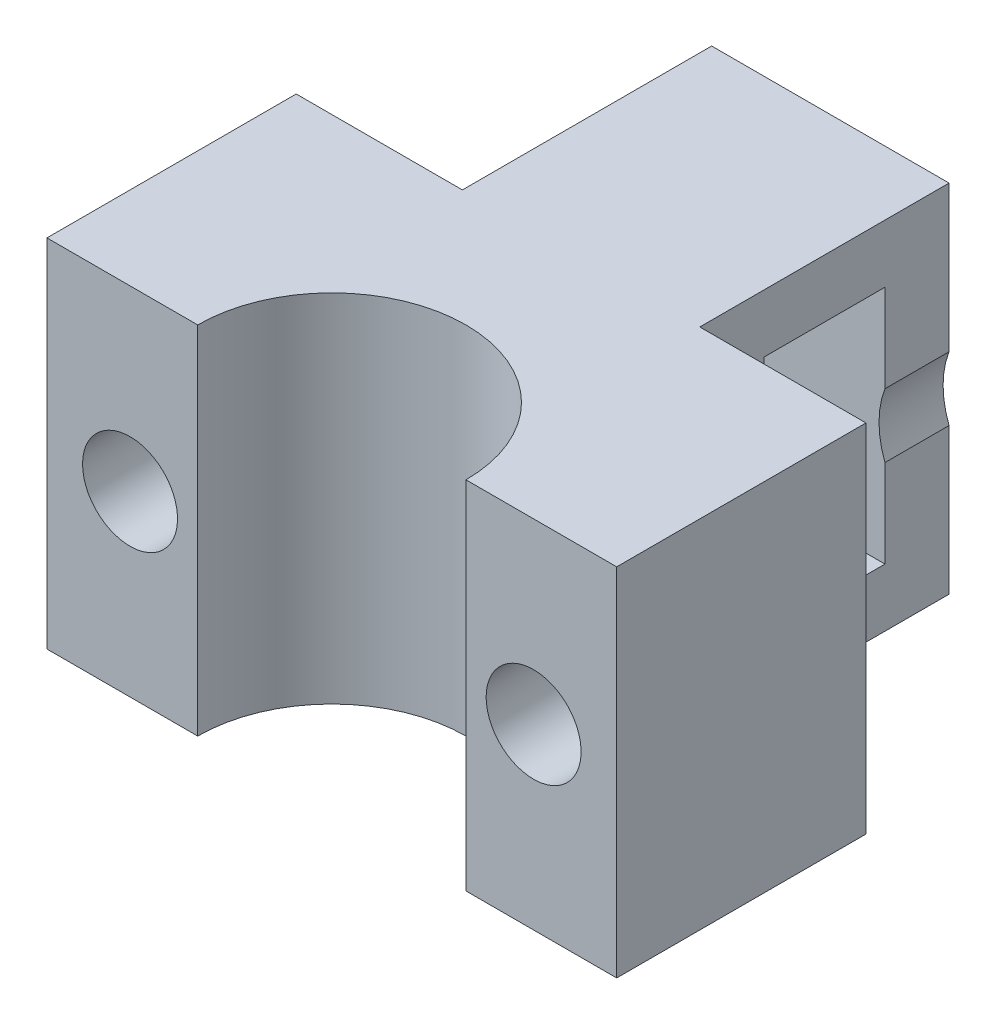
from build123d import *

# Parameters (mm, degrees)
SKETCH_1_W          = 48
SKETCH_1_H          = 20
EXTRUDE_1_DEPTH     = 30
SKETCH_2_W          = 14
SKETCH_2_H          = 30
CUT_EXTRUDE_1_DEPTH = 7
SKETCH_7_W          = 22
SKETCH_7_H          = 30
EXTRUDE_2_DEPTH     = 48
SKETCH_8_W          = 21
SKETCH_8_H          = 30
CUT_EXTRUDE_2_DEPTH = 14
SKETCH_9_W          = 21
SKETCH_9_H          = 30
CUT_EXTRUDE_3_DEPTH = 14
SKETCH_11_W         = 10.2
SKETCH_11_H         = 20.2
CUT_EXTRUDE_4_DEPTH = 56.497747702
SKETCH_13_R         = 4
CUT_EXTRUDE_5_DEPTH = 44.783558558
SKETCH_14_R         = 4
CUT_EXTRUDE_6_DEPTH = 44.783558558
FILLET_1_R          = 7
SKETCH_20_R         = 7.5
CUT_EXTRUDE_8_DEPTH = 44.783558558
SKETCH2_R           = 11.3
CUT_EXTRUDE1_DEPTH  = 51


with BuildPart() as part:
    # Эскиз1 → Бобышка-Вытянуть1 (new body)
    with BuildSketch(Plane(origin=(0, 0, 0), x_dir=(1, 0, 0), z_dir=(0, 1, 0))):
        Rectangle(SKETCH_1_W, SKETCH_1_H)
    extrude(amount=EXTRUDE_1_DEPTH)

    # Эскиз2 → Вырез-Вытянуть1 (cut)
    with BuildSketch(Plane.XY.offset(10)):
        with Locations((0, 15)):
            Rectangle(SKETCH_2_W, SKETCH_2_H)
    extrude(amount=-CUT_EXTRUDE_1_DEPTH, mode=Mode.SUBTRACT)

    # Эскиз7 → Бобышка-Вытянуть2 (add)
    with BuildSketch(Plane(origin=(24, 0, 0), x_dir=(0, 0, -1), z_dir=(1, 0, 0))):
        with Locations((21, 15)):
            Rectangle(SKETCH_7_W, SKETCH_7_H)
    extrude(amount=-EXTRUDE_2_DEPTH)

    # Эскиз8 → Вырез-Вытянуть2 (cut)
    with BuildSketch(Plane(origin=(24, 0, 0), x_dir=(0, 0, -1), z_dir=(1, 0, 0))):
        with Locations((21.5, 15)):
            Rectangle(SKETCH_8_W, SKETCH_8_H)
    extrude(amount=-CUT_EXTRUDE_2_DEPTH, mode=Mode.SUBTRACT)

    # Эскиз9 → Вырез-Вытянуть3 (cut)
    with BuildSketch(Plane.ZY.offset(24)):
        with Locations((-21.5, 15)):
            Rectangle(SKETCH_9_W, SKETCH_9_H)
    extrude(amount=-CUT_EXTRUDE_3_DEPTH, mode=Mode.SUBTRACT)

    # Эскиз11 → Вырез-Вытянуть4 (cut, through all)
    with BuildSketch(Plane.ZY.offset(10)):
        with Locations((-21.5, 15)):
            Rectangle(SKETCH_11_W, SKETCH_11_H)
    extrude(amount=-CUT_EXTRUDE_4_DEPTH, mode=Mode.SUBTRACT)

    # Эскиз13 → Вырез-Вытянуть5 (cut, through all)
    with BuildSketch(Plane(origin=(0, 0, -11), x_dir=(-1, 0, 0), z_dir=(0, 0, -1))):
        with Locations((17, 15)):
            Circle(SKETCH_13_R)
    extrude(amount=-CUT_EXTRUDE_5_DEPTH, mode=Mode.SUBTRACT)

    # Эскиз14 → Вырез-Вытянуть6 (cut, through all)
    with BuildSketch(Plane(origin=(0, 0, -11), x_dir=(-1, 0, 0), z_dir=(0, 0, -1))):
        with Locations((-17, 15)):
            Circle(SKETCH_14_R)
    extrude(amount=-CUT_EXTRUDE_6_DEPTH, mode=Mode.SUBTRACT)

    # Скругление1
    fillet_1_edges = [part.edges().sort_by_distance(p)[0] for p in [
        (-7, 15, 3),
        (7, 15, 3),
    ]]
    fillet(fillet_1_edges, radius=FILLET_1_R - 0.0001)  # a hair under: the kernel refuses the full size

    # Эскиз20 → Вырез-Вытянуть8 (cut, through all)
    with BuildSketch(Plane(origin=(0, 0, -11), x_dir=(-1, 0, 0), z_dir=(0, 0, -1))):
        with Locations((-17, 15)):
            Circle(SKETCH_20_R)
        with Locations((17, 15)):
            Circle(SKETCH_20_R)
    extrude(amount=CUT_EXTRUDE_8_DEPTH, mode=Mode.SUBTRACT)

    # Sketch2 → Cut-Extrude1 (cut, through all)
    with BuildSketch(Plane(origin=(0, 30, 0), x_dir=(1, 0, 0), z_dir=(0, 1, 0))):
        with Locations((0, -10)):
            Circle(SKETCH2_R)
    extrude(amount=-CUT_EXTRUDE1_DEPTH, mode=Mode.SUBTRACT)


solid = part.part
